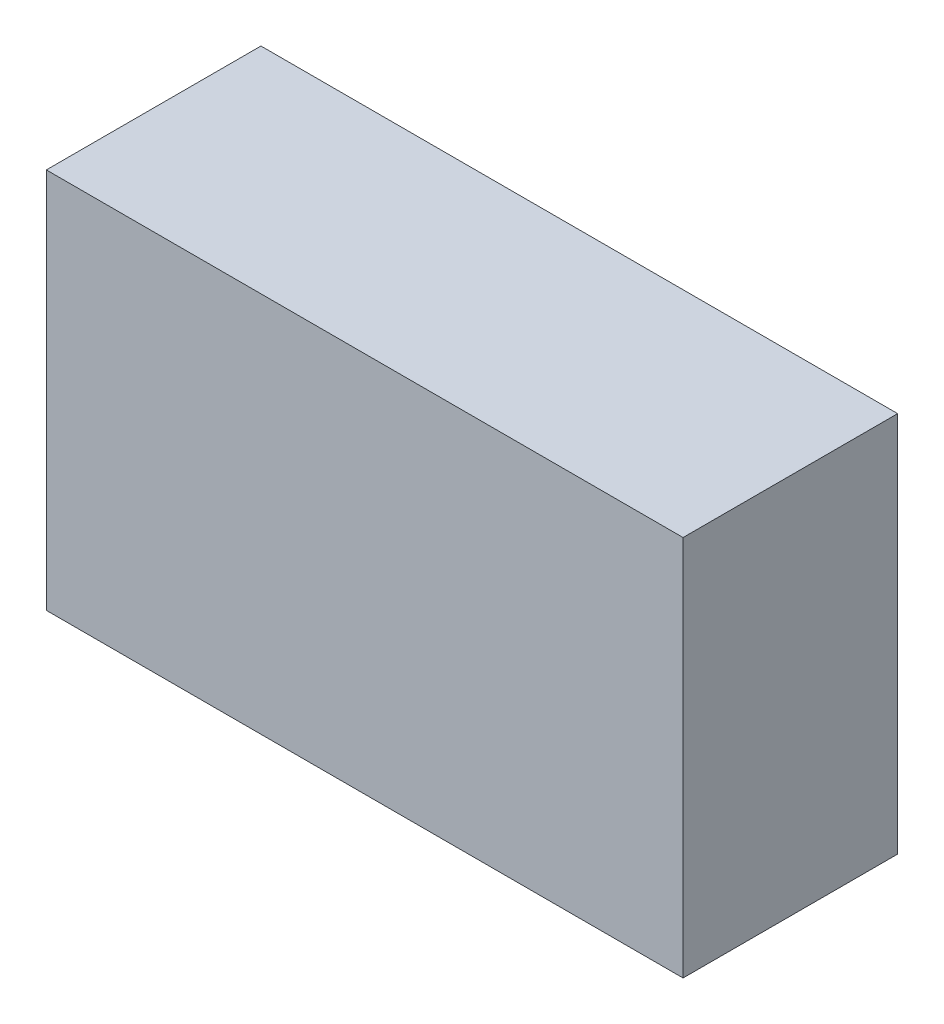
from build123d import *

# Parameters (mm, degrees)
SKETCH_1_W      = 29.670919937
SKETCH_1_H      = 17.775845147
EXTRUDE_1_DEPTH = 10


with BuildPart() as part:
    # 草圖1 → 填料-伸長1 (new body)
    with BuildSketch(Plane.XY):
        with Locations((14.835459969, 8.887922574)):
            Rectangle(SKETCH_1_W, SKETCH_1_H)
    extrude(amount=EXTRUDE_1_DEPTH)


solid = part.part
